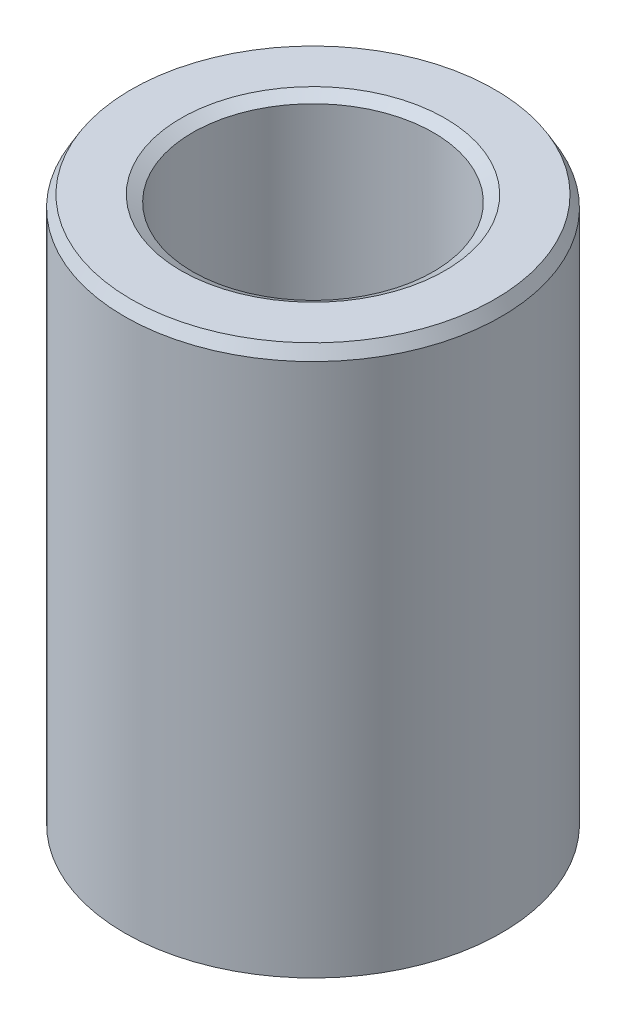
from build123d import *
from OCP.BRepFilletAPI import BRepFilletAPI_MakeChamfer

# Parameters (mm, degrees)
SKETCH1_R           = 42.5
BOSS_EXTRUDE1_DEPTH = 124.511362412
SKETCH2_R           = 27.17351526
CUT_EXTRUDE1_DEPTH  = 139.259102303
CHAMFER1_SIZE       = 2.609379948
CHAMFER1_SIZE2      = 1.501291184


with BuildPart() as part:
    # Sketch1 → Boss-Extrude1 (new body)
    with BuildSketch(Plane(origin=(0, 0, 0), x_dir=(1, 0, 0), z_dir=(0, 1, 0))):
        Circle(SKETCH1_R)
    extrude(amount=BOSS_EXTRUDE1_DEPTH)

    # Sketch2 → Cut-Extrude1 (cut, through all)
    with BuildSketch(Plane(origin=(0, 0, 0), x_dir=(1, 0, 0), z_dir=(0, 1, 0))):
        Circle(SKETCH2_R)
    extrude(amount=CUT_EXTRUDE1_DEPTH, mode=Mode.SUBTRACT)

    # Chamfer1: one chamfer whose edges measure the first distance from different faces: ONE call of the kernel's chamfer builder (chamfer() names one face for all edges)
    chamfer1_edges_1 = [part.edges().sort_by_distance(p)[0] for p in [
        (-27.17351526, 124.511362412, 0),
    ]]
    chamfer1_side_1 = [part.faces().sort_by_distance(p)[0] for p in [
        (-41.297918472, 124.511362412, 0),
    ]]
    chamfer1_edges_2 = [part.edges().sort_by_distance(p)[0] for p in [
        (-27.17351526, 0, 0),
    ]]
    chamfer1_side_2 = [part.faces().sort_by_distance(p)[0] for p in [
        (-27.17351526, 62.255681206, 0),
    ]]
    chamfer1_edges_3 = [part.edges().sort_by_distance(p)[0] for p in [
        (-42.5, 0, 0),
    ]]
    chamfer1_side_3 = [part.faces().sort_by_distance(p)[0] for p in [
        (-41.297918472, 0, 0),
    ]]
    chamfer1_edges_4 = [part.edges().sort_by_distance(p)[0] for p in [
        (-42.5, 124.511362412, 0),
    ]]
    chamfer1_side_4 = [part.faces().sort_by_distance(p)[0] for p in [
        (-42.5, 62.255681206, 0),
    ]]
    chamfer1 = BRepFilletAPI_MakeChamfer(part.part.solid().wrapped)
    for e in chamfer1_edges_1:
        chamfer1.Add(CHAMFER1_SIZE, CHAMFER1_SIZE2, e.wrapped, chamfer1_side_1[0].wrapped)  # the first distance lies on this face
    for e in chamfer1_edges_2:
        chamfer1.Add(CHAMFER1_SIZE, CHAMFER1_SIZE2, e.wrapped, chamfer1_side_2[0].wrapped)  # the first distance lies on this face
    for e in chamfer1_edges_3:
        chamfer1.Add(CHAMFER1_SIZE, CHAMFER1_SIZE2, e.wrapped, chamfer1_side_3[0].wrapped)  # the first distance lies on this face
    for e in chamfer1_edges_4:
        chamfer1.Add(CHAMFER1_SIZE, CHAMFER1_SIZE2, e.wrapped, chamfer1_side_4[0].wrapped)  # the first distance lies on this face
    add(Compound.cast(chamfer1.Shape()), mode=Mode.REPLACE)


solid = part.part
